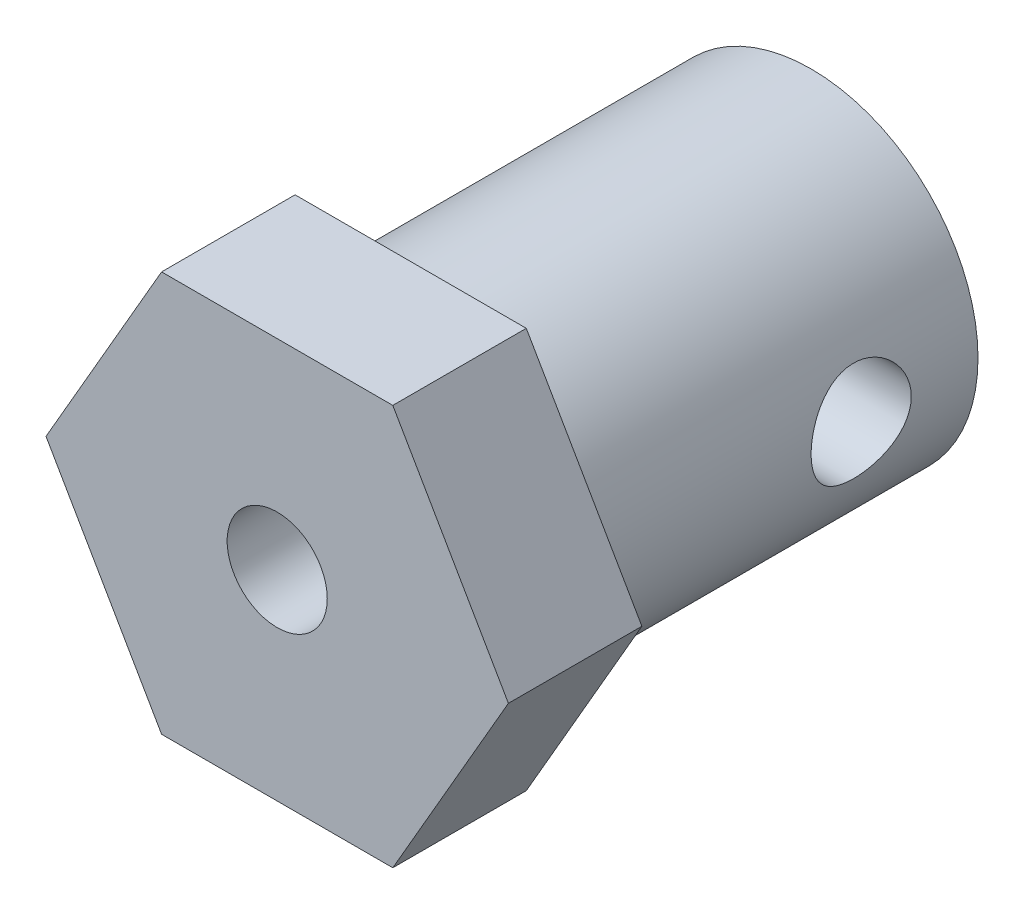
from build123d import *

# Parameters (mm, degrees)
CROQUIS2_R              = 1.5
SALIENTE_EXTRUIR1_DEPTH = 4
CROQUIS3_R              = 5
CROQUIS3_R_2            = 2.5
SALIENTE_EXTRUIR2_DEPTH = 12
CROQUIS4_R              = 1.5
CORTAR_EXTRUIR1_DEPTH   = 10


with BuildPart() as part:
    # Croquis2 → Saliente-Extruir1 (new body)
    with BuildSketch(Plane.XY):
        Polygon((3.464101615, 6), (-3.464101615, 6), (-6.92820323, 0), (-3.464101615, -6), (3.464101615, -6), (6.92820323, 0), align=None)
        Circle(CROQUIS2_R, mode=Mode.SUBTRACT)
    extrude(amount=SALIENTE_EXTRUIR1_DEPTH)

    # Croquis3 → Saliente-Extruir2 (add)
    with BuildSketch(Plane(origin=(0, 0, 0), x_dir=(-1, 0, 0), z_dir=(0, 0, -1))):
        Circle(CROQUIS3_R)
        Circle(CROQUIS3_R_2, mode=Mode.SUBTRACT)
    extrude(amount=SALIENTE_EXTRUIR2_DEPTH)

    # Croquis4 → Cortar-Extruir1 (cut)
    with BuildSketch(Plane(origin=(0, 0, 0), x_dir=(0, 0, -1), z_dir=(1, 0, 0))):
        with Locations((8.5, 0)):
            Circle(CROQUIS4_R)
    extrude(amount=CORTAR_EXTRUIR1_DEPTH, mode=Mode.SUBTRACT)


solid = part.part
